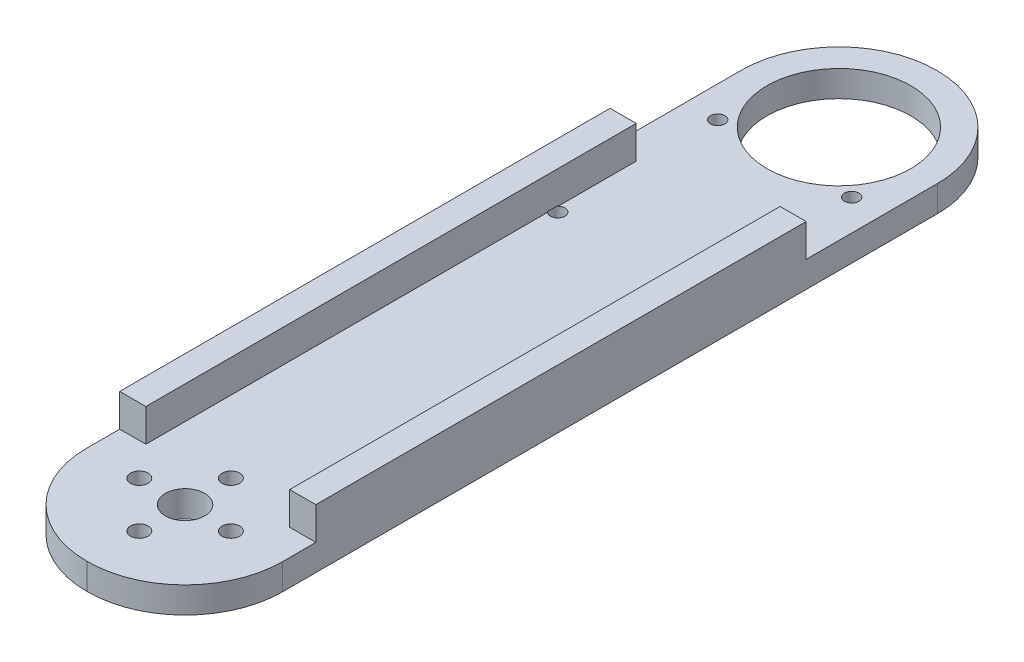
from build123d import *

# Parameters (mm, degrees)
BOSS_1_DEPTH  = 4
S_BOX2_W      = 4
S_BOX2_H      = 5.5
BOSS_2_DEPTH  = 75
S_BOX3_W      = 4
S_BOX3_H      = 5.5
BOSS_3_DEPTH  = 75
S_HOLE4_R     = 3
HOLE_4_DEPTH  = 4.2
S_HOLE5_R     = 1.35
HOLE_5_DEPTH  = 4.2
S_HOLE6_R     = 1.35
HOLE_6_DEPTH  = 4.2
S_HOLE7_R     = 1.35
HOLE_7_DEPTH  = 4.2
S_HOLE8_R     = 1.35
HOLE_8_DEPTH  = 4.2
S_HOLE9_R     = 11
HOLE_9_DEPTH  = 4.2
S_HOLE10_R    = 1.1
HOLE_10_DEPTH = 4.2
S_HOLE11_R    = 1.1
HOLE_11_DEPTH = 4.2
S_HOLE12_R    = 1.1
HOLE_12_DEPTH = 4.2
S_HOLE13_R    = 1.1
HOLE_13_DEPTH = 4.2


with BuildPart() as part:
    # S_prism1 → Boss_1 (new body)
    with BuildSketch(Plane(origin=(0, 18.625, 0), x_dir=(1, 0, 0), z_dir=(0, 1, 0))):
        with BuildLine():
            Line((-0.1, -15), (0.1, -15))
            ThreePointArc((0.1, -15), (10.6359, -10.6359), (15, -0.1))
            Line((15, -0.1), (15, 100.1))
            ThreePointArc((15, 100.1), (10.6359, 110.6359), (0.1, 115))
            Line((0.1, 115), (-0.1, 115))
            ThreePointArc((-0.1, 115), (-10.6359, 110.6359), (-15, 100.1))
            Line((-15, 100.1), (-15, -0.1))
            ThreePointArc((-15, -0.1), (-10.6359, -10.6359), (-0.1, -15))
        make_face()
    extrude(amount=BOSS_1_DEPTH)

    # S_box2 → Boss_2 (add)
    with BuildSketch(Plane.XY.offset(-80)):
        with Locations((-13, 24.875)):
            Rectangle(S_BOX2_W, S_BOX2_H)
    extrude(amount=BOSS_2_DEPTH)

    # S_box3 → Boss_3 (add)
    with BuildSketch(Plane.XY.offset(-80)):
        with Locations((13, 24.875)):
            Rectangle(S_BOX3_W, S_BOX3_H)
    extrude(amount=BOSS_3_DEPTH)

    # S_hole4 → Hole_4 (cut)
    with BuildSketch(Plane(origin=(0, 18.525, 0), x_dir=(1, 0, 0), z_dir=(0, 1, 0))):
        Circle(S_HOLE4_R)
    extrude(amount=HOLE_4_DEPTH, mode=Mode.SUBTRACT)

    # S_hole5 → Hole_5 (cut)
    with BuildSketch(Plane(origin=(0, 18.525, 0), x_dir=(1, 0, 0), z_dir=(0, 1, 0))):
        with Locations((7, 0)):
            Circle(S_HOLE5_R)
    extrude(amount=HOLE_5_DEPTH, mode=Mode.SUBTRACT)

    # S_hole6 → Hole_6 (cut)
    with BuildSketch(Plane(origin=(0, 18.525, 0), x_dir=(1, 0, 0), z_dir=(0, 1, 0))):
        with Locations((0, -7)):
            Circle(S_HOLE6_R)
    extrude(amount=HOLE_6_DEPTH, mode=Mode.SUBTRACT)

    # S_hole7 → Hole_7 (cut)
    with BuildSketch(Plane(origin=(0, 18.525, 0), x_dir=(1, 0, 0), z_dir=(0, 1, 0))):
        with Locations((-7, 0)):
            Circle(S_HOLE7_R)
    extrude(amount=HOLE_7_DEPTH, mode=Mode.SUBTRACT)

    # S_hole8 → Hole_8 (cut)
    with BuildSketch(Plane(origin=(0, 18.525, 0), x_dir=(1, 0, 0), z_dir=(0, 1, 0))):
        with Locations((0, 7)):
            Circle(S_HOLE8_R)
    extrude(amount=HOLE_8_DEPTH, mode=Mode.SUBTRACT)

    # S_hole9 → Hole_9 (cut)
    with BuildSketch(Plane(origin=(0, 18.525, 0), x_dir=(1, 0, 0), z_dir=(0, 1, 0))):
        with Locations((0, 100)):
            Circle(S_HOLE9_R)
    extrude(amount=HOLE_9_DEPTH, mode=Mode.SUBTRACT)

    # S_hole10 → Hole_10 (cut)
    with BuildSketch(Plane(origin=(0, 18.525, 0), x_dir=(1, 0, 0), z_dir=(0, 1, 0))):
        with Locations((-10.25, 91.7)):
            Circle(S_HOLE10_R)
    extrude(amount=HOLE_10_DEPTH, mode=Mode.SUBTRACT)

    # S_hole11 → Hole_11 (cut)
    with BuildSketch(Plane(origin=(0, 18.525, 0), x_dir=(1, 0, 0), z_dir=(0, 1, 0))):
        with Locations((10.25, 91.7)):
            Circle(S_HOLE11_R)
    extrude(amount=HOLE_11_DEPTH, mode=Mode.SUBTRACT)

    # S_hole12 → Hole_12 (cut)
    with BuildSketch(Plane(origin=(0, 18.525, 0), x_dir=(1, 0, 0), z_dir=(0, 1, 0))):
        with Locations((-10.25, 67.25)):
            Circle(S_HOLE12_R)
    extrude(amount=HOLE_12_DEPTH, mode=Mode.SUBTRACT)

    # S_hole13 → Hole_13 (cut)
    with BuildSketch(Plane(origin=(0, 18.525, 0), x_dir=(1, 0, 0), z_dir=(0, 1, 0))):
        with Locations((10.25, 67.25)):
            Circle(S_HOLE13_R)
    extrude(amount=HOLE_13_DEPTH, mode=Mode.SUBTRACT)


solid = part.part
